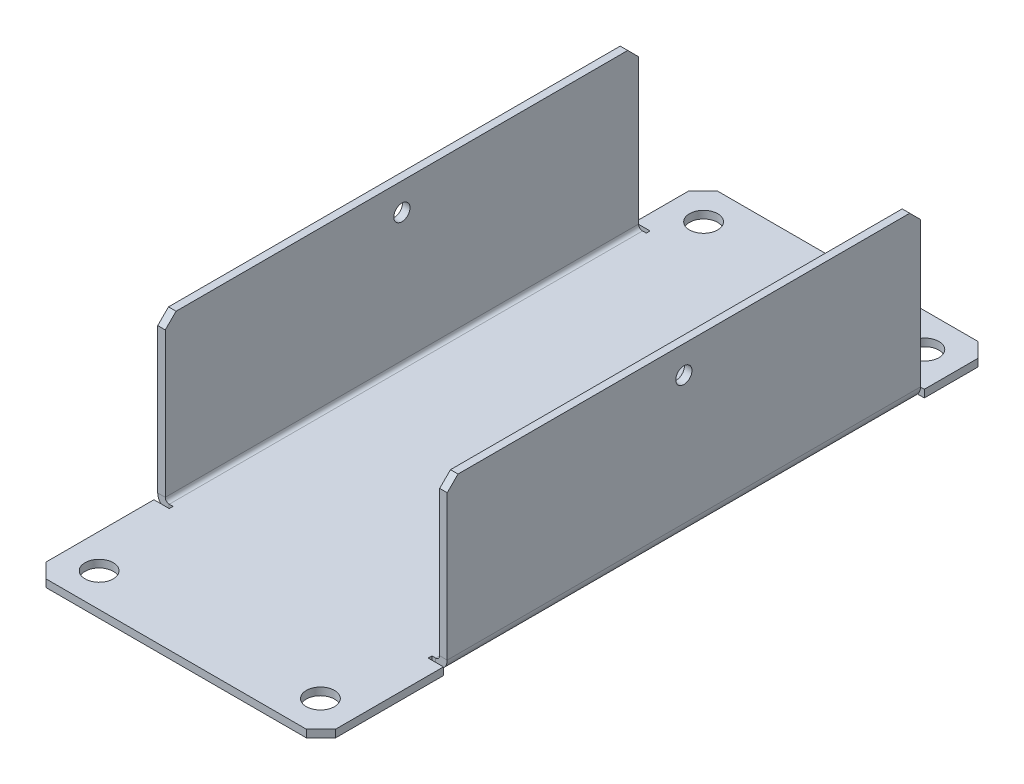
from build123d import *

# Parameters (mm, degrees)
SKETCH1_W                       = 53.65
SKETCH1_H                       = 124.45
SKETCH1_R                       = 2.61
BASE_FLANGE1_DEPTH              = 1.4
CHAMFER1_SIZE                   = 2.7
EDGE_FLANGE2_STRIP_W            = 7.0732
EDGE_FLANGE2_STRIP_H            = 1.4
EDGE_FLANGE2_STRIP_CUT_DEPTH    = 87.7
EDGE_FLANGE2_RELIEF_W           = 7.7732
EDGE_FLANGE2_RELIEF_H           = 0.7
EDGE_FLANGE2_RELIEF_CUT_DEPTH   = 1.4
EDGE_FLANGE2_STRIP_2_W          = 7.0732
EDGE_FLANGE2_STRIP_2_H          = 1.4
EDGE_FLANGE2_STRIP_CUT_2_DEPTH  = 87.7
EDGE_FLANGE2_RELIEF_2_W         = 7.7732
EDGE_FLANGE2_RELIEF_2_H         = 0.7
EDGE_FLANGE2_RELIEF_CUT_2_DEPTH = 1.4
EDGE_FLANGE2_DEPTH              = 87.7
EDGE_FLANGE2_BEND_DEPTH         = 87.7
CHAMFER2_SIZE                   = 2
SKETCH18_R                      = 1.5
CUT_EXTRUDE1_DEPTH              = 88.329451647


# Sheet-metal steps are written as plain solids
with BuildPart() as part:
    # Sketch1 → Base-Flange1 (new body)
    with BuildSketch(Plane(origin=(0, 0, 0), x_dir=(1, 0, 0), z_dir=(0, 1, 0))):
        Rectangle(SKETCH1_W, SKETCH1_H)
        with Locations(Location((-20.5, 56, 0), (0, 0, 270))):
            Circle(SKETCH1_R, mode=Mode.SUBTRACT)
        with Locations(Location((20.5, 56, 0), (0, 0, 270))):
            Circle(SKETCH1_R, mode=Mode.SUBTRACT)
        with Locations(Location((20.5, -56, 0), (0, 0, 270))):
            Circle(SKETCH1_R, mode=Mode.SUBTRACT)
        with Locations(Location((-20.5, -56, 0), (0, 0, 270))):
            Circle(SKETCH1_R, mode=Mode.SUBTRACT)
    extrude(amount=-BASE_FLANGE1_DEPTH)

    # Chamfer1
    chamfer1_edges = [part.edges().sort_by_distance(p)[0] for p in [
        (26.825, -0.7, 62.225),
        (-26.825, -0.7, 62.225),
        (-26.825, -0.7, -62.225),
        (26.825, -0.7, -62.225),
    ]]
    chamfer(chamfer1_edges, length=CHAMFER1_SIZE)

    # Edge-Flange2 strip (across the edge) → Edge-Flange2 strip cut (cut)
    with BuildSketch(Plane(origin=(26.825, 0, 38.825), x_dir=(-1, 0, 0), z_dir=(0, 0, -1))):
        with Locations((-1.4, -0.7)):
            Rectangle(EDGE_FLANGE2_STRIP_W, EDGE_FLANGE2_STRIP_H)
    extrude(amount=EDGE_FLANGE2_STRIP_CUT_DEPTH, mode=Mode.SUBTRACT)

    # Edge-Flange2 relief (on the sheet) → Edge-Flange2 relief cut (cut)
    with BuildSketch(Plane(origin=(24.6884, 0, 38.825), x_dir=(-1, 0, 0), z_dir=(0, 1, 0))):
        with Locations((-3.1866, 0.35)):
            Rectangle(EDGE_FLANGE2_RELIEF_W, EDGE_FLANGE2_RELIEF_H)
        with Locations((-3.1866, -88.05)):
            Rectangle(EDGE_FLANGE2_RELIEF_W, EDGE_FLANGE2_RELIEF_H)
    extrude(amount=-EDGE_FLANGE2_RELIEF_CUT_DEPTH, mode=Mode.SUBTRACT)

    # Edge-Flange2 strip 2 (across the edge) → Edge-Flange2 strip cut 2 (cut)
    with BuildSketch(Plane(origin=(-26.825, 0, -48.875), x_dir=(1, 0, 0), z_dir=(0, 0, 1))):
        with Locations((-1.4, -0.7)):
            Rectangle(EDGE_FLANGE2_STRIP_2_W, EDGE_FLANGE2_STRIP_2_H)
    extrude(amount=EDGE_FLANGE2_STRIP_CUT_2_DEPTH, mode=Mode.SUBTRACT)

    # Edge-Flange2 relief 2 (on the sheet) → Edge-Flange2 relief cut 2 (cut)
    with BuildSketch(Plane(origin=(-24.6884, 0, -48.875), x_dir=(1, 0, 0), z_dir=(0, 1, 0))):
        with Locations((-3.1866, 0.35)):
            Rectangle(EDGE_FLANGE2_RELIEF_2_W, EDGE_FLANGE2_RELIEF_2_H)
        with Locations((-3.1866, -88.05)):
            Rectangle(EDGE_FLANGE2_RELIEF_2_W, EDGE_FLANGE2_RELIEF_2_H)
    extrude(amount=-EDGE_FLANGE2_RELIEF_CUT_2_DEPTH, mode=Mode.SUBTRACT)

    # Edge-Flange2 section (across the edge) → Edge-Flange2 (add)
    with BuildSketch(Plane(origin=(26.825, 0, 38.825), x_dir=(-1, 0, 0), z_dir=(0, 0, -1))):
        with BuildLine():
            Line((0, 0.7366), (0, 29.6))
            Line((0, 29.6), (1.4, 29.6))
            Line((1.4, 29.6), (1.4, 0.7366))
            ThreePointArc((1.4, 0.7366), (1.615745145, 0.215745145), (2.1366, 0))
            Line((2.1366, 0), (2.1366, -1.4))
            ThreePointArc((2.1366, -1.4), (0.625795651, -0.774204349), (0, 0.7366))
        make_face()
    extrude(amount=EDGE_FLANGE2_DEPTH)

    # Edge-Flange2 section 2 (across the edge) → Edge-Flange2 bend (add)
    with BuildSketch(Plane(origin=(-26.825, 0, -48.875), x_dir=(1, 0, 0), z_dir=(0, 0, 1))):
        with BuildLine():
            Line((0, 0.7366), (0, 29.6))
            Line((0, 29.6), (1.4, 29.6))
            Line((1.4, 29.6), (1.4, 0.7366))
            ThreePointArc((1.4, 0.7366), (1.615745145, 0.215745145), (2.1366, 0))
            Line((2.1366, 0), (2.1366, -1.4))
            ThreePointArc((2.1366, -1.4), (0.625795651, -0.774204349), (0, 0.7366))
        make_face()
    extrude(amount=EDGE_FLANGE2_BEND_DEPTH)

    # Chamfer2
    chamfer2_edges = [part.edges().sort_by_distance(p)[0] for p in [
        (26.125, 29.6, 38.825),
        (26.125, 29.6, -48.875),
        (-26.125, 29.6, -48.875),
        (-26.125, 29.6, 38.825),
    ]]
    chamfer(chamfer2_edges, length=CHAMFER2_SIZE)

    # Sketch18 → Cut-Extrude1 (cut, through all)
    with BuildSketch(Plane(origin=(26.825, 0, 0), x_dir=(0, 0, -1), z_dir=(1, 0, 0))):
        with Locations(Location((5.025, 24.54, 0), (0, 0, 90))):
            Circle(SKETCH18_R)
    extrude(amount=-CUT_EXTRUDE1_DEPTH, mode=Mode.SUBTRACT)


solid = part.part
